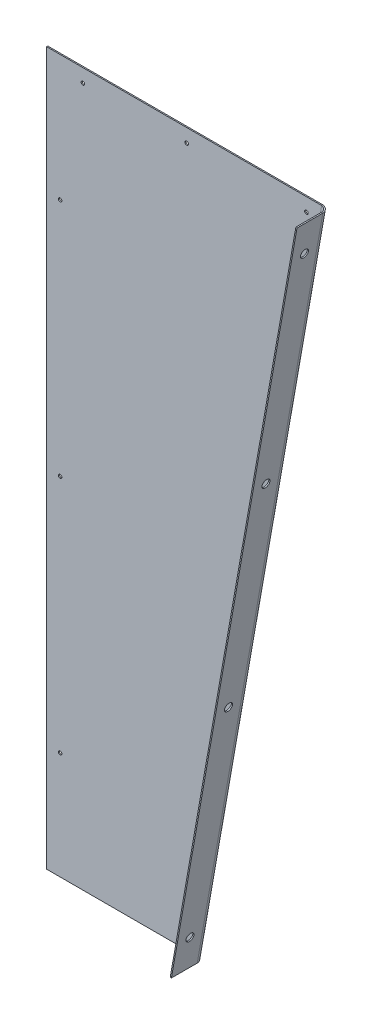
from build123d import *

# Parameters (mm, degrees)
BASE_FLANGE1_START = -1.89738
BASE_FLANGE1_DEPTH = 1.89738
EDGE_FLANGE5_DEPTH = 1150.646018509
SKETCH21_R         = 2.778125
CUT_EXTRUDE1_DEPTH = 1.89738
SKETCH22_R         = 6.350000004
CUT_EXTRUDE2_DEPTH = 1144.944756983


# Read off the part's stored shape, not the designer's step: Base-Flange1
# Sheet-metal steps are written as plain solids
with BuildPart() as part:
    # Base-Flange1 outline → Base-Flange1 (new body)
    with BuildSketch(Plane.XY.offset(BASE_FLANGE1_START)):
        Polygon((241.231741087, -1133.16512), (441.039325341, 0), (3.468308846, 0), (3.468308846, -1133.16512), align=None)
    extrude(amount=BASE_FLANGE1_DEPTH)

    # Edge-Flange5 section (across the edge) → Edge-Flange5 (add)
    with BuildSketch(Plane(origin=(249.048652626, -1134.54345241, 0), x_dir=(-0.9848077530122076, 0.17364817766693405, 3.4914813388431337e-15), z_dir=(0.17364817766693405, 0.9848077530122076, 0))):
        with BuildLine():
            Line((-1.89738, 7.9375), (-1.89738, 48.90262))
            Line((-1.89738, 48.90262), (0, 48.90262))
            Line((0, 48.90262), (0, 7.9375))
            ThreePointArc((0, 7.9375), (2.324839924, 2.324839924), (7.9375, 0))
            Line((7.9375, 0), (7.9375, -1.89738))
            ThreePointArc((7.9375, -1.89738), (0.98318966, 0.98318966), (-1.89738, 7.9375))
        make_face()
    extrude(amount=EDGE_FLANGE5_DEPTH)

    # Sketch21 → Cut-Extrude1 (cut)
    with BuildSketch(Plane.XY):
        with Locations((416.722567093, -21.43125)):
            Circle(SKETCH21_R)
        with Locations((226.222567093, -21.43125)):
            Circle(SKETCH21_R)
        with Locations((61.122567093, -21.43125)):
            Circle(SKETCH21_R)
        with Locations((24.899558846, -200.266935)):
            Circle(SKETCH21_R)
        with Locations((24.899558846, -581.266935)):
            Circle(SKETCH21_R)
        with Locations((24.899558846, -962.266935)):
            Circle(SKETCH21_R)
    extrude(amount=-CUT_EXTRUDE1_DEPTH, mode=Mode.SUBTRACT)

    # Sketch22 → Cut-Extrude2 (cut, through all)
    with BuildSketch(Plane(origin=(435.557273959, -76.800499043, 0), x_dir=(0, 0, 1), z_dir=(-0.9848077530122062, 0.17364817766694032, 3.3536738181639377e-15))):
        with Locations(Location((28.26512, 25.785675125, 0), (0, 0, 270))):
            Circle(SKETCH22_R)
        with Locations(Location((28.26512, -327.287334129, 0), (0, 0, 270))):
            Circle(SKETCH22_R)
        with Locations(Location((28.26512, -670.187334129, 0), (0, 0, 270))):
            Circle(SKETCH22_R)
        with Locations(Location((28.26512, -1023.260343384, 0), (0, 0, 270))):
            Circle(SKETCH22_R)
    extrude(amount=-CUT_EXTRUDE2_DEPTH, mode=Mode.SUBTRACT)


solid = part.part
